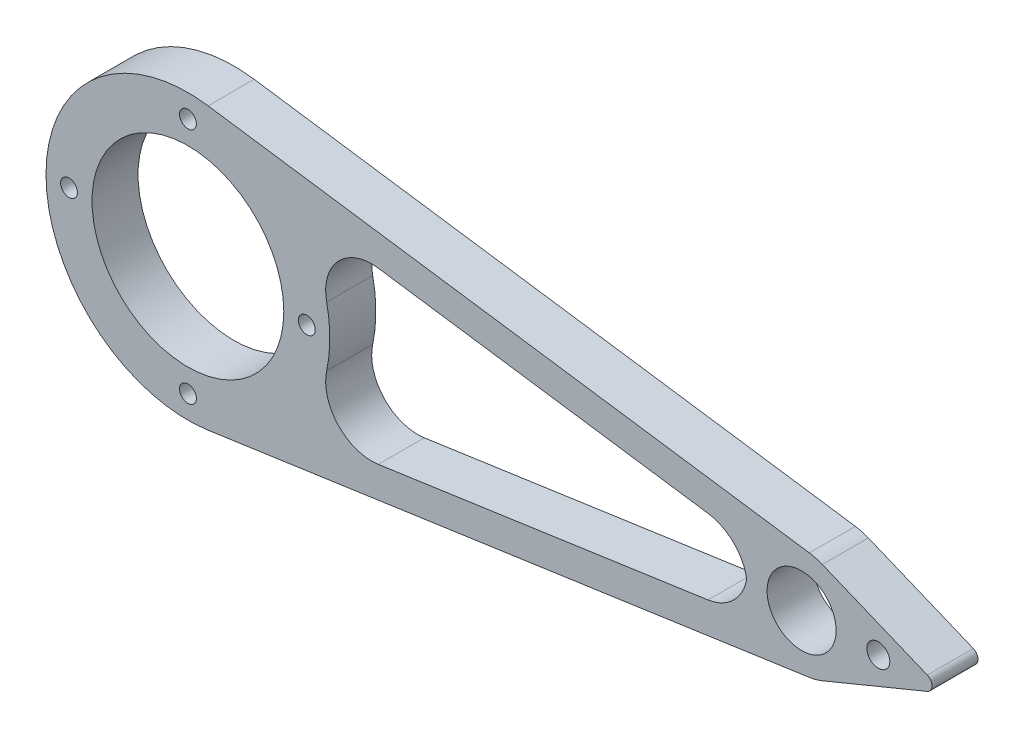
from build123d import *

# Parameters (mm, degrees)
ESQUISSE1_R             = 18.5
ESQUISSE1_R_2           = 1.1
ESQUISSE1_R_3           = 12.5
BOSS_EXTRU_1_DEPTH      = 6
BOSS_EXTRU_2_START      = -6
ESQUISSE2_R             = 4.5
BOSS_EXTRU_2_DEPTH      = 6
ENL_V_MAT_EXTRU_1_DEPTH = 90.244943834
CONG_1_R                = 6
BOSS_EXTRU_3_START      = -6
ESQUISSE4_R             = 1.5
BOSS_EXTRU_3_DEPTH      = 6


with BuildPart() as part:
    # Esquisse1 → Boss.-Extru.1 (new body)
    with BuildSketch(Plane.XY):
        Circle(ESQUISSE1_R)
        with Locations((0, 15.5)):
            Circle(ESQUISSE1_R_2, mode=Mode.SUBTRACT)
        with Locations((15.5, 0)):
            Circle(ESQUISSE1_R_2, mode=Mode.SUBTRACT)
        with Locations((0, -15.5)):
            Circle(ESQUISSE1_R_2, mode=Mode.SUBTRACT)
        with Locations((-15.5, 0)):
            Circle(ESQUISSE1_R_2, mode=Mode.SUBTRACT)
        Circle(ESQUISSE1_R_3, mode=Mode.SUBTRACT)
    extrude(amount=BOSS_EXTRU_1_DEPTH)

    # Esquisse2 → Boss.-Extru.2 (add)
    with BuildSketch(Plane.XY.offset(6).offset(BOSS_EXTRU_2_START)):
        with BuildLine():
            Line((2.63625, 18.311203836), (81.01175, 7.027543094))
            ThreePointArc((81.01175, 7.027543094), (87.1, 0), (81.01175, -7.027543094))
            Line((81.01175, -7.027543094), (2.63625, -18.311203836))
            ThreePointArc((2.63625, -18.311203836), (18.5, 0), (2.63625, 18.311203836))
        make_face()
        with Locations((80, 0)):
            Circle(ESQUISSE2_R, mode=Mode.SUBTRACT)
    extrude(amount=BOSS_EXTRU_2_DEPTH)

    # Esquisse3 → Enlèv. mat.-Extru.1 (cut, through all)
    with BuildSketch(Plane.XY.offset(6)):
        with BuildLine():
            Line((13.438126494, 12.714824274), (74.119447809, 3.978580893))
            ThreePointArc((74.119447809, 3.978580893), (72.9, 0), (74.119447809, -3.978580893))
            Line((74.119447809, -3.978580893), (13.438126494, -12.714824274))
            ThreePointArc((13.438126494, -12.714824274), (18.5, 0), (13.438126494, 12.714824274))
        make_face()
    extrude(amount=-ENL_V_MAT_EXTRU_1_DEPTH, mode=Mode.SUBTRACT)

    # Congé1
    # the kernel refuses this fillet: 6 mm, written as the material it adds along each edge
    with BuildSketch(Plane(origin=(74.119447809, -3.978580893, 6), x_dir=(-0.989794801966549, -0.1424999999999999, 0), z_dir=(0, 0, -1))) as cong_1_piece_1:
        with BuildLine():
            CenterArc((6.387487769, 6), CONG_1_R, 192.789750134, 77.210249866)
            ThreePointArc((0.536353935, 4.671755725), (0.666177836, 2.290184264), (0, 0))
            Line((0, 0), (6.387487769, 0))
        make_face()
    extrude(amount=6)
    with BuildSketch(Plane(origin=(74.119447809, 3.978580893, 6), x_dir=(-0.25446461339287313, -0.9670820857253097, 0), z_dir=(0, 0, -1))) as cong_1_piece_2:
        with BuildLine():
            CenterArc((6.689391795, 5.661451882), CONG_1_R, 173.450673101, 77.210249866)
            Line((0.728547621, 6.345803209), (0, 0))
            ThreePointArc((0, 0), (2.351221868, 0.400615273), (4.702443737, 0))
        make_face()
    extrude(amount=6)
    with BuildSketch(Plane(origin=(13.438126494, -12.714824274, 6), x_dir=(0.46579561947351233, 0.8848923329305587, 0), z_dir=(0, 0, -1))) as cong_1_piece_3:
        with BuildLine():
            CenterArc((11.602632031, 5.777450125), CONG_1_R, 144.04573826, 110.300190842)
            Line((6.745716297, 9.300285568), (0, 0))
            ThreePointArc((0, 0), (4.99183006, 0.686195447), (9.98366012, 0))
        make_face()
    extrude(amount=6)
    with BuildSketch(Plane(origin=(13.438126494, 12.714824274, 6), x_dir=(0.4657956194735124, -0.8848923329305588, 0), z_dir=(0, 0, -1))) as cong_1_piece_4:
        with BuildLine():
            CenterArc((11.602632031, -5.777450125), CONG_1_R, 105.654070898, 110.300190842)
            Line((6.745716297, -9.300285568), (0, 0))
            ThreePointArc((0, 0), (4.99183006, -0.686195447), (9.98366012, 0))
        make_face()
    extrude(amount=6)

    # Esquisse4 → Boss.-Extru.3 (add)
    with BuildSketch(Plane.XY.offset(6).offset(BOSS_EXTRU_3_START)):
        with BuildLine():
            Line((82.706875, 6.563751041), (96.38125, 0.924471978))
            ThreePointArc((96.38125, 0.924471978), (97, 0), (96.38125, -0.924471978))
            Line((96.38125, -0.924471978), (82.706875, -6.563751041))
            ThreePointArc((82.706875, -6.563751041), (87.1, 0), (82.706875, 6.563751041))
        make_face()
        with Locations((90, 0)):
            Circle(ESQUISSE4_R, mode=Mode.SUBTRACT)
    extrude(amount=BOSS_EXTRU_3_DEPTH)


solid = part.part
